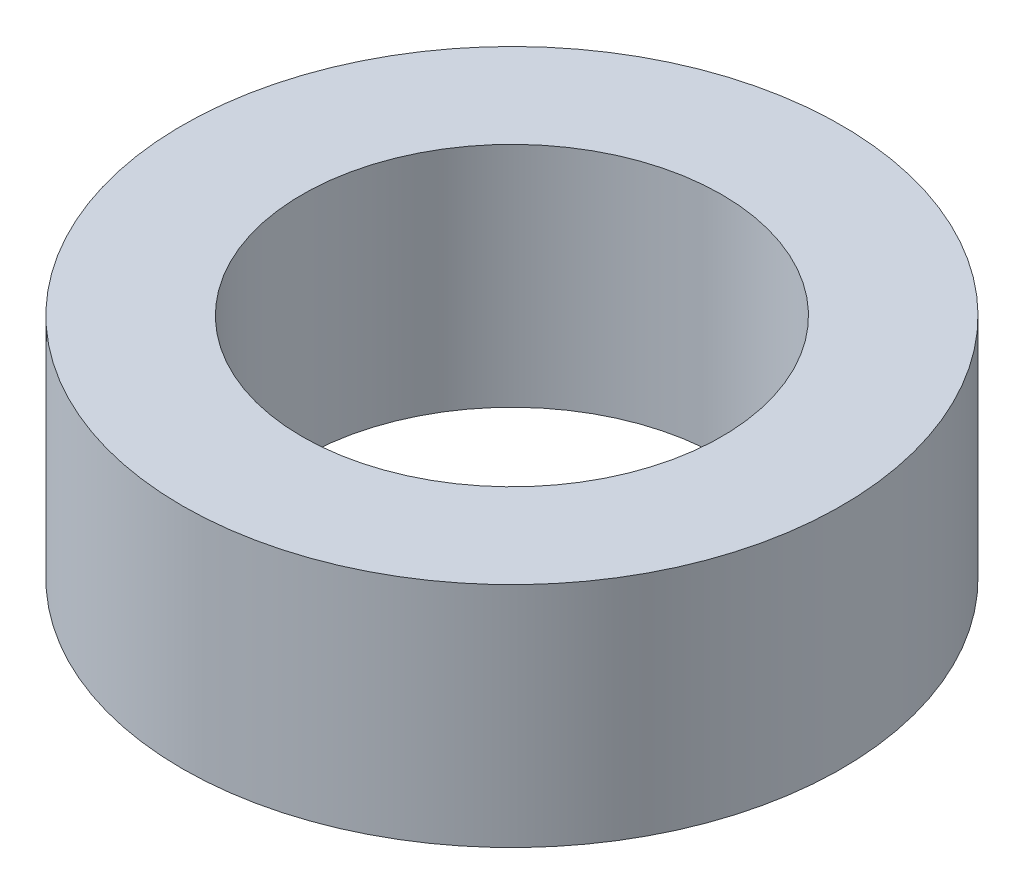
from build123d import *

# Parameters (mm, degrees)
SKETCH1_R           = 27.5
BOSS_EXTRUDE1_DEPTH = 19
SKETCH2_R           = 17.5
CUT_EXTRUDE1_DEPTH  = 44.283946216


with BuildPart() as part:
    # Sketch1 → Boss-Extrude1 (new body)
    with BuildSketch(Plane(origin=(0, 0, 0), x_dir=(1, 0, 0), z_dir=(0, 1, 0))):
        Circle(SKETCH1_R)
    extrude(amount=BOSS_EXTRUDE1_DEPTH)

    # Sketch2 → Cut-Extrude1 (cut, through all)
    with BuildSketch(Plane(origin=(0, 0, 0), x_dir=(1, 0, 0), z_dir=(0, 1, 0))):
        Circle(SKETCH2_R)
    extrude(amount=CUT_EXTRUDE1_DEPTH, mode=Mode.SUBTRACT)


solid = part.part
